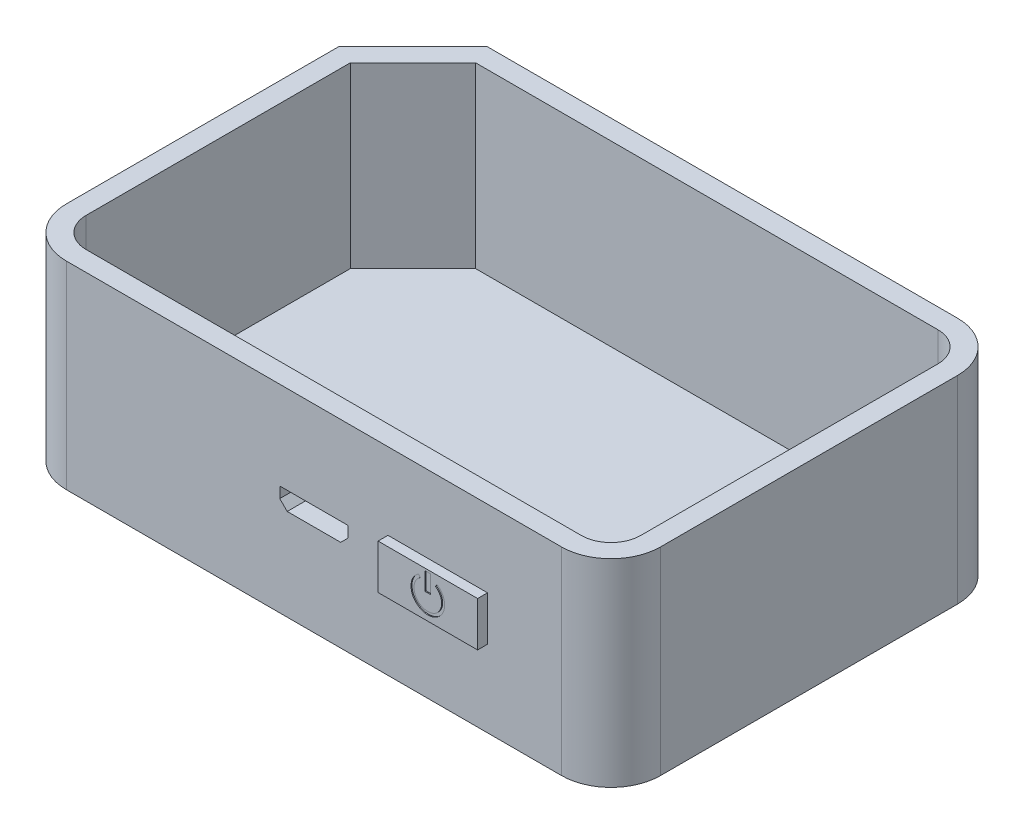
from build123d import *

# Parameters (mm, degrees)
SKETCH4_W           = 60
SKETCH4_H           = 40
BOSS_EXTRUDE1_DEPTH = 20
FILLET1_R           = 5
FILLET2_R           = 5
CUT_EXTRUDE1_DEPTH  = 8
CUT_EXTRUDE2_DEPTH  = 8
SKETCH8_R           = 1.5
CUT_EXTRUDE4_DEPTH  = 8
SHELL3_START        = 2
SHELL3_DEPTH        = 18
SKETCH9_W           = 10.049922194
SKETCH9_H           = 4.5
BOSS_EXTRUDE2_DEPTH = 1
SKETCH10_W          = 0.584985694
SKETCH10_H          = 1.811393404
CUT_EXTRUDE5_DEPTH  = 0.1
CUT_EXTRUDE6_DEPTH  = 5.1


# Read off the part's stored shape, not the designer's step: Shell3
with BuildPart() as part:
    # Sketch4 → Boss-Extrude1 (new body)
    with BuildSketch(Plane(origin=(0, 0, 0), x_dir=(1, 0, 0), z_dir=(0, 1, 0))):
        with Locations((-9.826955075, -12.370810554)):
            Rectangle(SKETCH4_W, SKETCH4_H)
    extrude(amount=BOSS_EXTRUDE1_DEPTH)

    # Fillet1
    fillet1_edges = [part.edges().sort_by_distance(p)[0] for p in [
        (20.173044925, 10, 32.370810554),
    ]]
    fillet(fillet1_edges, radius=FILLET1_R)

    # Fillet2
    fillet2_edges = [part.edges().sort_by_distance(p)[0] for p in [
        (20.173044925, 10, -7.629189446),
        (-39.826955075, 10, 32.370810554),
    ]]
    fillet(fillet2_edges, radius=FILLET2_R)

    # Sketch6 → Cut-Extrude1 (cut)
    with BuildSketch(Plane(origin=(0, 20, 0), x_dir=(1, 0, 0), z_dir=(0, 1, 0))):
        Polygon((-32.326955075, 7.629189446), (-39.826955075, 0.129189446), (-39.826955075, 7.629189446), align=None)
    extrude(amount=-CUT_EXTRUDE1_DEPTH, mode=Mode.SUBTRACT)

    # Sketch7 → Cut-Extrude2 (cut)
    with BuildSketch(Plane.XZ):
        Polygon((-32.326955075, -7.629189446), (-39.826955075, -0.129189446), (-39.826955075, -7.629189446), align=None)
    extrude(amount=-CUT_EXTRUDE2_DEPTH, mode=Mode.SUBTRACT)

    # Sketch8 → Cut-Extrude4 (cut)
    with BuildSketch(Plane(origin=(0, 12, 0), x_dir=(1, 0, 0), z_dir=(0, 1, 0))):
        with Locations(Location((-37.501831714, 5.285439446, 0), (0, 0, 270))):
            Circle(SKETCH8_R)
    extrude(amount=-CUT_EXTRUDE4_DEPTH, mode=Mode.SUBTRACT)

    # Shell3 outline → Shell3 (cut)
    with BuildSketch(Plane(origin=(0, 0, 0), x_dir=(1, 0, 0), z_dir=(0, 1, 0)).offset(SHELL3_START)):
        with BuildLine():
            Line((-37.826955075, -0.699237679), (-37.826955075, -27.370810554))
            ThreePointArc((-37.826955075, -27.370810554), (-36.948275418, -29.492130897), (-34.826955075, -30.370810554))
            Line((-34.826955075, -30.370810554), (15.173044925, -30.370810554))
            ThreePointArc((15.173044925, -30.370810554), (17.294365268, -29.492130897), (18.173044925, -27.370810554))
            Line((18.173044925, -27.370810554), (18.173044925, 2.629189446))
            ThreePointArc((18.173044925, 2.629189446), (17.294365269, 4.75050979), (15.173044925, 5.629189446))
            Line((15.173044925, 5.629189446), (-31.49852795, 5.629189446))
            Line((-31.49852795, 5.629189446), (-37.826955075, -0.699237679))
        make_face()
    extrude(amount=SHELL3_DEPTH, mode=Mode.SUBTRACT)

    # Sketch9 → Boss-Extrude2 (add)
    with BuildSketch(Plane.XY.offset(32.370810554)):
        with Locations((2.673044925, 10)):
            Rectangle(SKETCH9_W, SKETCH9_H)
    extrude(amount=BOSS_EXTRUDE2_DEPTH)

    # Sketch10 → Cut-Extrude5 (cut)
    with BuildSketch(Plane.XY.offset(33.370810554)):
        with BuildLine():
            Line((1.902705655, 11.169007018), (1.738142725, 11.418734932))
            ThreePointArc((1.738142725, 11.418734932), (2.673044925, 8.300926449), (3.607947125, 11.418734932))
            Line((3.607947125, 11.418734932), (3.443384196, 11.169007018))
            ThreePointArc((3.443384196, 11.169007018), (2.673044925, 8.6), (1.902705655, 11.169007018))
        make_face()
        with Locations((2.673044925, 11.125)):
            Rectangle(SKETCH10_W, SKETCH10_H)
    extrude(amount=-CUT_EXTRUDE5_DEPTH, mode=Mode.SUBTRACT)

    # Sketch11 → Cut-Extrude6 (cut)
    with BuildSketch(Plane.XY.offset(32.370810554)):
        Polygon((-13.276955075, 10), (-13.276955075, 11.1), (-6.376955075, 11.1), (-6.376955075, 10), (-7.126955075, 9.25), (-9.826955075, 9.25), (-12.526955075, 9.25), align=None)
    extrude(amount=-CUT_EXTRUDE6_DEPTH, mode=Mode.SUBTRACT)


solid = part.part
